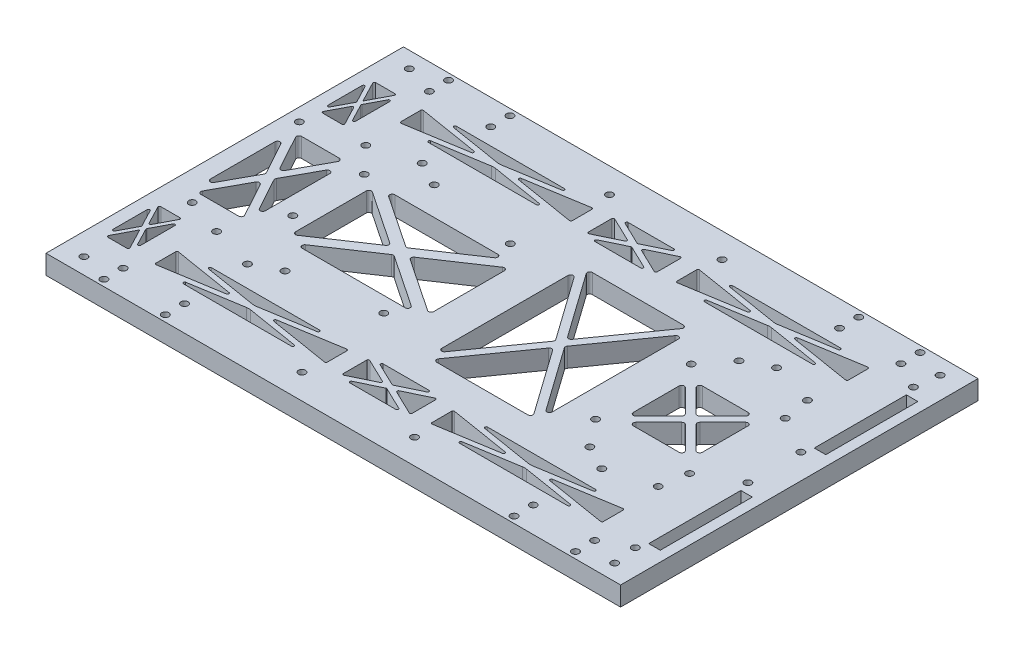
from build123d import *

# Parameters (mm, degrees)
SKETCH6_W                               = 224.59
SKETCH6_H                               = 139.7
CHASSISBASE_DEPTH                       = 7.5
ARDUINOMEGAMOUNTINGHOLESSKETCH_R        = 1.375
ARDUINOMEGAMOUNTINGHOLES_DEPTH          = 7.5
FRONTMOTORMOUNTINGHOLESSKETCH_R         = 1.375
FRONTMOTORMOUNTINGHOLES_DEPTH           = 7.5
L298MOTORDRIVERMOUNTINGHOLESSKETCH_R    = 1.375
L298MOTORDRIVERMOUNTINGHOLES_DEPTH      = 7.5
COUPLINGCOLLARMOUNTINGHOLESSKETCH_R     = 1.375
COUPLINGCOLLARMOUNTINGHOLES_DEPTH       = 7.5
SIDEDISTANCESENSORMOUNTINGHOLESSKETCH_R = 1.375
SIDEDISTANCESENSORMOUNTINGHOLES_DEPTH   = 7.5
TOPCHASSISMOUNTINGHOLESSKETCH_R         = 1.375
TOPCHASSISMOUNTINGHOLES_DEPTH           = 7.5
REARSENSORMOUNTINGHOLESSKETCH_R         = 1.375
REARSENSORMOUNTINGHOLES_DEPTH           = 7.5
SKETCH7_W                               = 4.5
SKETCH7_H                               = 36
WEIGHTREDUCTION_DEPTH                   = 245.559130069


with BuildPart() as part:
    # Sketch6 → chassisBase (new body)
    with BuildSketch(Plane(origin=(0, 0, 0), x_dir=(1, 0, 0), z_dir=(0, 1, 0))):
        with Locations((112.295, 26.65)):
            Rectangle(SKETCH6_W, SKETCH6_H)
    extrude(amount=CHASSISBASE_DEPTH)

    # arduinoMegaMountingHolesSketch → arduinoMegaMountingHoles (cut)
    with BuildSketch(Plane(origin=(0, 0, 0), x_dir=(1, 0, 0), z_dir=(0, 1, 0))):
        with Locations((5.05, 50.76)):
            Circle(ARDUINOMEGAMOUNTINGHOLESSKETCH_R)
        with Locations((87.52, 50.76)):
            Circle(ARDUINOMEGAMOUNTINGHOLESSKETCH_R)
        with Locations((86.29, 2.54)):
            Circle(ARDUINOMEGAMOUNTINGHOLESSKETCH_R)
        with Locations((11.41, 2.54)):
            Circle(ARDUINOMEGAMOUNTINGHOLESSKETCH_R)
        with Locations((35.5, 45.68)):
            Circle(ARDUINOMEGAMOUNTINGHOLESSKETCH_R)
        with Locations((35.5, 17.77)):
            Circle(ARDUINOMEGAMOUNTINGHOLESSKETCH_R)
    extrude(amount=ARDUINOMEGAMOUNTINGHOLES_DEPTH, mode=Mode.SUBTRACT)

    # frontMotorMountingHolesSketch → frontMotorMountingHoles (cut)
    with BuildSketch(Plane(origin=(0, 0, 0), x_dir=(1, 0, 0), z_dir=(0, 1, 0))):
        with Locations((25.985, 55.8)):
            Circle(FRONTMOTORMOUNTINGHOLESSKETCH_R)
        with Locations((43.035, 60.8)):
            Circle(FRONTMOTORMOUNTINGHOLESSKETCH_R)
        with Locations((52.735, 55.8)):
            Circle(FRONTMOTORMOUNTINGHOLESSKETCH_R)
        with Locations((25.985, -2.5)):
            Circle(FRONTMOTORMOUNTINGHOLESSKETCH_R)
        with Locations((43.035, -7.5)):
            Circle(FRONTMOTORMOUNTINGHOLESSKETCH_R)
        with Locations((52.735, -2.5)):
            Circle(FRONTMOTORMOUNTINGHOLESSKETCH_R)
    extrude(amount=FRONTMOTORMOUNTINGHOLES_DEPTH, mode=Mode.SUBTRACT)

    # L298motorDriverMountingHolesSketch → L298motorDriverMountingHoles (cut)
    with BuildSketch(Plane(origin=(0, 0, 0), x_dir=(1, 0, 0), z_dir=(0, 1, 0))):
        with Locations((163.60569727, 45.38594237)):
            Circle(L298MOTORDRIVERMOUNTINGHOLESSKETCH_R)
        with Locations((163.60569727, 8.0064415)):
            Circle(L298MOTORDRIVERMOUNTINGHOLESSKETCH_R)
        with Locations((200.347497622, 45.38594237)):
            Circle(L298MOTORDRIVERMOUNTINGHOLESSKETCH_R)
        with Locations((200.34749759, 8.0064415)):
            Circle(L298MOTORDRIVERMOUNTINGHOLESSKETCH_R)
        with Locations((171.855, 55.8)):
            Circle(L298MOTORDRIVERMOUNTINGHOLESSKETCH_R)
        with Locations((181.555, 60.8)):
            Circle(L298MOTORDRIVERMOUNTINGHOLESSKETCH_R)
        with Locations((198.605, 55.8)):
            Circle(L298MOTORDRIVERMOUNTINGHOLESSKETCH_R)
        with Locations((198.605, -2.5)):
            Circle(L298MOTORDRIVERMOUNTINGHOLESSKETCH_R)
        with Locations((181.555, -7.5)):
            Circle(L298MOTORDRIVERMOUNTINGHOLESSKETCH_R)
        with Locations((171.855, -2.5)):
            Circle(L298MOTORDRIVERMOUNTINGHOLESSKETCH_R)
    extrude(amount=L298MOTORDRIVERMOUNTINGHOLES_DEPTH, mode=Mode.SUBTRACT)

    # couplingCollarMountingHolesSketch → couplingCollarMountingHoles (cut)
    with BuildSketch(Plane(origin=(0, 0, 0), x_dir=(1, 0, 0), z_dir=(0, 1, 0))):
        with Locations((20.135, 86.5)):
            Circle(COUPLINGCOLLARMOUNTINGHOLESSKETCH_R)
        with Locations((20.135, 94)):
            Circle(COUPLINGCOLLARMOUNTINGHOLESSKETCH_R)
        with Locations((44.135, 86.5)):
            Circle(COUPLINGCOLLARMOUNTINGHOLESSKETCH_R)
        with Locations((44.135, 94)):
            Circle(COUPLINGCOLLARMOUNTINGHOLESSKETCH_R)
        with Locations((204.455, 86.5)):
            Circle(COUPLINGCOLLARMOUNTINGHOLESSKETCH_R)
        with Locations((180.455, 86.5)):
            Circle(COUPLINGCOLLARMOUNTINGHOLESSKETCH_R)
        with Locations((180.455, 94)):
            Circle(COUPLINGCOLLARMOUNTINGHOLESSKETCH_R)
        with Locations((204.455, 94)):
            Circle(COUPLINGCOLLARMOUNTINGHOLESSKETCH_R)
        with Locations((20.135, -33.2)):
            Circle(COUPLINGCOLLARMOUNTINGHOLESSKETCH_R)
        with Locations((44.135, -33.2)):
            Circle(COUPLINGCOLLARMOUNTINGHOLESSKETCH_R)
        with Locations((44.135, -40.7)):
            Circle(COUPLINGCOLLARMOUNTINGHOLESSKETCH_R)
        with Locations((20.135, -40.7)):
            Circle(COUPLINGCOLLARMOUNTINGHOLESSKETCH_R)
        with Locations((180.455, -33.2)):
            Circle(COUPLINGCOLLARMOUNTINGHOLESSKETCH_R)
        with Locations((204.455, -33.2)):
            Circle(COUPLINGCOLLARMOUNTINGHOLESSKETCH_R)
        with Locations((204.455, -40.7)):
            Circle(COUPLINGCOLLARMOUNTINGHOLESSKETCH_R)
        with Locations((180.455, -40.7)):
            Circle(COUPLINGCOLLARMOUNTINGHOLESSKETCH_R)
    extrude(amount=COUPLINGCOLLARMOUNTINGHOLES_DEPTH, mode=Mode.SUBTRACT)

    # sideDistanceSensorMountingHolesSketch → sideDistanceSensorMountingHoles (cut)
    with BuildSketch(Plane(origin=(0, 0, 0), x_dir=(1, 0, 0), z_dir=(0, 1, 0))):
        with Locations((90.295, -33.45)):
            Circle(SIDEDISTANCESENSORMOUNTINGHOLESSKETCH_R)
        with Locations((134.295, -33.45)):
            Circle(SIDEDISTANCESENSORMOUNTINGHOLESSKETCH_R)
        with Locations((90.295, 86.75)):
            Circle(SIDEDISTANCESENSORMOUNTINGHOLESSKETCH_R)
        with Locations((134.295, 86.75)):
            Circle(SIDEDISTANCESENSORMOUNTINGHOLESSKETCH_R)
    extrude(amount=SIDEDISTANCESENSORMOUNTINGHOLES_DEPTH, mode=Mode.SUBTRACT)

    # topChassisMountingHolesSketch → topChassisMountingHoles (cut)
    with BuildSketch(Plane(origin=(0, 0, 0), x_dir=(1, 0, 0), z_dir=(0, 1, 0))):
        with Locations((8.5675, 90.25)):
            Circle(TOPCHASSISMOUNTINGHOLESSKETCH_R)
        with Locations((8.5675, -36.95)):
            Circle(TOPCHASSISMOUNTINGHOLESSKETCH_R)
        with Locations((216.0225, 90.25)):
            Circle(TOPCHASSISMOUNTINGHOLESSKETCH_R)
        with Locations((216.0225, -36.95)):
            Circle(TOPCHASSISMOUNTINGHOLESSKETCH_R)
    extrude(amount=TOPCHASSISMOUNTINGHOLES_DEPTH, mode=Mode.SUBTRACT)

    # rearSensorMountingHolesSketch → rearSensorMountingHoles (cut)
    with BuildSketch(Plane(origin=(0, 0, 0), x_dir=(1, 0, 0), z_dir=(0, 1, 0))):
        with Locations((214.84, 81)):
            Circle(REARSENSORMOUNTINGHOLESSKETCH_R)
        with Locations((214.84, 37)):
            Circle(REARSENSORMOUNTINGHOLESSKETCH_R)
        with Locations((214.84, -27.7)):
            Circle(REARSENSORMOUNTINGHOLESSKETCH_R)
        with Locations((214.84, 16.3)):
            Circle(REARSENSORMOUNTINGHOLESSKETCH_R)
    extrude(amount=REARSENSORMOUNTINGHOLES_DEPTH, mode=Mode.SUBTRACT)

    # Sketch7 → weightReduction (cut, through all)
    with BuildSketch(Plane(origin=(0, 7.5, 0), x_dir=(1, 0, 0), z_dir=(0, 1, 0))):
        with BuildLine():
            Line((170.362106781, 36.321572875), (179.326572875, 27.357106781))
            ThreePointArc((179.326572875, 27.357106781), (179.619466094, 26.65), (179.326572875, 25.942893219))
            Line((179.326572875, 25.942893219), (170.362106781, 16.978427125))
            ThreePointArc((170.362106781, 16.978427125), (169.272316568, 16.761654373), (168.655, 17.685533906))
            Line((168.655, 17.685533906), (168.655, 35.614466094))
            ThreePointArc((168.655, 35.614466094), (169.272316568, 36.538345627), (170.362106781, 36.321572875))
        make_face()
        with BuildLine():
            Line((172.483427125, 38.442893219), (181.447893219, 29.478427125))
            ThreePointArc((181.447893219, 29.478427125), (182.155, 29.185533906), (182.862106781, 29.478427125))
            Line((182.862106781, 29.478427125), (191.826572875, 38.442893219))
            ThreePointArc((191.826572875, 38.442893219), (192.043345627, 39.532683432), (191.119466094, 40.15))
            Line((191.119466094, 40.15), (173.190533906, 40.15))
            ThreePointArc((173.190533906, 40.15), (172.266654373, 39.532683432), (172.483427125, 38.442893219))
        make_face()
        with BuildLine():
            Line((173.190533906, 13.15), (191.119466094, 13.15))
            ThreePointArc((191.119466094, 13.15), (192.043345627, 13.767316568), (191.826572875, 14.857106781))
            Line((191.826572875, 14.857106781), (182.862106781, 23.821572875))
            ThreePointArc((182.862106781, 23.821572875), (182.155, 24.114466094), (181.447893219, 23.821572875))
            Line((181.447893219, 23.821572875), (172.483427125, 14.857106781))
            ThreePointArc((172.483427125, 14.857106781), (172.266654373, 13.767316568), (173.190533906, 13.15))
        make_face()
        with BuildLine():
            Line((195.655, 17.685533906), (195.655, 35.614466094))
            ThreePointArc((195.655, 35.614466094), (195.037683432, 36.538345627), (193.947893219, 36.321572875))
            Line((193.947893219, 36.321572875), (184.983427125, 27.357106781))
            ThreePointArc((184.983427125, 27.357106781), (184.690533906, 26.65), (184.983427125, 25.942893219))
            Line((184.983427125, 25.942893219), (193.947893219, 16.978427125))
            ThreePointArc((193.947893219, 16.978427125), (195.037683432, 16.761654373), (195.655, 17.685533906))
        make_face()
        with BuildLine():
            Line((113.294715761, -3.75), (148.880284239, -3.75))
            ThreePointArc((148.880284239, -3.75), (149.768717571, -3.209005681), (149.695876132, -2.17137243))
            Line((149.695876132, -2.17137243), (131.903091892, 22.908059163))
            ThreePointArc((131.903091892, 22.908059163), (131.0875, 23.329431593), (130.271908108, 22.908059163))
            Line((130.271908108, 22.908059163), (112.479123868, -2.17137243))
            ThreePointArc((112.479123868, -2.17137243), (112.406282429, -3.209005681), (113.294715761, -3.75))
        make_face()
        with BuildLine():
            Line((109.52, 1.980096633), (109.52, 51.319903367))
            ThreePointArc((109.52, 51.319903367), (110.216348796, 52.27268663), (111.335591892, 51.898530938))
            Line((111.335591892, 51.898530938), (128.837833368, 27.22862757))
            ThreePointArc((128.837833368, 27.22862757), (129.022241476, 26.65), (128.837833368, 26.07137243))
            Line((128.837833368, 26.07137243), (111.335591892, 1.401469062))
            ThreePointArc((111.335591892, 1.401469062), (110.216348796, 1.02731337), (109.52, 1.980096633))
        make_face()
        with BuildLine():
            Line((113.294715761, 57.05), (148.880284239, 57.05))
            ThreePointArc((148.880284239, 57.05), (149.768717571, 56.509005681), (149.695876132, 55.47137243))
            Line((149.695876132, 55.47137243), (131.903091892, 30.391940837))
            ThreePointArc((131.903091892, 30.391940837), (131.0875, 29.970568407), (130.271908108, 30.391940837))
            Line((130.271908108, 30.391940837), (112.479123868, 55.47137243))
            ThreePointArc((112.479123868, 55.47137243), (112.406282429, 56.509005681), (113.294715761, 57.05))
        make_face()
        with BuildLine():
            Line((152.655, 1.980096633), (152.655, 51.319903367))
            ThreePointArc((152.655, 51.319903367), (151.958651204, 52.27268663), (150.839408108, 51.898530938))
            Line((150.839408108, 51.898530938), (133.337166632, 27.22862757))
            ThreePointArc((133.337166632, 27.22862757), (133.152758524, 26.65), (133.337166632, 26.07137243))
            Line((133.337166632, 26.07137243), (150.839408108, 1.401469062))
            ThreePointArc((150.839408108, 1.401469062), (151.958651204, 1.02731337), (152.655, 1.980096633))
        make_face()
        with BuildLine():
            Line((103.334561275, 81), (121.255438725, 81))
            ThreePointArc((121.255438725, 81), (121.742926141, 80.611157634), (121.472190515, 80.049424078))
            Line((121.472190515, 80.049424078), (112.51175179, 75.738960427))
            ThreePointArc((112.51175179, 75.738960427), (112.295, 75.689536349), (112.07824821, 75.738960427))
            Line((112.07824821, 75.738960427), (103.117809485, 80.049424078))
            ThreePointArc((103.117809485, 80.049424078), (102.847073859, 80.611157634), (103.334561275, 81))
        make_face()
        with BuildLine():
            Line((125.755, 69.955063838), (125.755, 79.094936162))
            ThreePointArc((125.755, 79.094936162), (125.521105341, 79.518242136), (125.03824821, 79.545512084))
            Line((125.03824821, 79.545512084), (115.538427245, 74.975575922))
            ThreePointArc((115.538427245, 74.975575922), (115.255179035, 74.525), (115.538427245, 74.074424078))
            Line((115.538427245, 74.074424078), (125.03824821, 69.504487916))
            ThreePointArc((125.03824821, 69.504487916), (125.521105341, 69.531757864), (125.755, 69.955063838))
        make_face()
        with BuildLine():
            Line((37.11356333, -25.706546713), (57.528535299, -22.370069951))
            ThreePointArc((57.528535299, -22.370069951), (58.335, -22.304602825), (59.141464701, -22.370069951))
            Line((59.141464701, -22.370069951), (79.55643667, -25.706546713))
            ThreePointArc((79.55643667, -25.706546713), (79.974150834, -26.240455879), (79.4757902, -26.7))
            Line((79.4757902, -26.7), (37.1942098, -26.7))
            ThreePointArc((37.1942098, -26.7), (36.695849166, -26.240455879), (37.11356333, -25.706546713))
        make_face()
        with BuildLine():
            Line((6.672598406, 58.3), (14.162401594, 58.3))
            ThreePointArc((14.162401594, 58.3), (14.59014905, 58.541094392), (14.605386455, 59.031871544))
            Line((14.605386455, 59.031871544), (10.860484861, 66.186413584))
            ThreePointArc((10.860484861, 66.186413584), (10.4175, 66.454542039), (9.974515139, 66.186413584))
            Line((9.974515139, 66.186413584), (6.229613545, 59.031871544))
            ThreePointArc((6.229613545, 59.031871544), (6.24485095, 58.541094392), (6.672598406, 58.3))
        make_face()
        with BuildLine():
            Line((5, 61.950695617), (5, 75.349304383))
            ThreePointArc((5, 75.349304383), (5.380610784, 75.834841421), (5.942984861, 75.581175928))
            Line((5.942984861, 75.581175928), (9.449601431, 68.881871544))
            ThreePointArc((9.449601431, 68.881871544), (9.50661657, 68.65), (9.449601431, 68.418128456))
            Line((9.449601431, 68.418128456), (5.942984861, 61.718824072))
            ThreePointArc((5.942984861, 61.718824072), (5.380610784, 61.465158579), (5, 61.950695617))
        make_face()
        with BuildLine():
            Line((6.672598406, 79), (14.162401594, 79))
            ThreePointArc((14.162401594, 79), (14.59014905, 78.758905608), (14.605386455, 78.268128456))
            Line((14.605386455, 78.268128456), (10.4175, 70.267274776))
            Line((10.4175, 70.267274776), (6.229613545, 78.268128456))
            ThreePointArc((6.229613545, 78.268128456), (6.24485095, 78.758905608), (6.672598406, 79))
        make_face()
        with BuildLine():
            Line((15.835, 61.950695617), (15.835, 75.349304383))
            ThreePointArc((15.835, 75.349304383), (15.454389216, 75.834841421), (14.892015139, 75.581175928))
            Line((14.892015139, 75.581175928), (11.385398569, 68.881871544))
            ThreePointArc((11.385398569, 68.881871544), (11.32838343, 68.65), (11.385398569, 68.418128456))
            Line((11.385398569, 68.418128456), (14.892015139, 61.718824072))
            ThreePointArc((14.892015139, 61.718824072), (15.454389216, 61.465158579), (15.835, 61.950695617))
        make_face()
        with BuildLine():
            Line((24.835, -17.351617124), (24.835, -25.098382876))
            ThreePointArc((24.835, -25.098382876), (25.011212442, -25.479383686), (25.41564647, -25.591836163))
            Line((25.41564647, -25.591836163), (49.1157974, -21.718453287))
            ThreePointArc((49.1157974, -21.718453287), (49.53515093, -21.225), (49.1157974, -20.731546713))
            Line((49.1157974, -20.731546713), (25.41564647, -16.858163837))
            ThreePointArc((25.41564647, -16.858163837), (25.011212442, -16.970616314), (24.835, -17.351617124))
        make_face()
        with BuildLine():
            Line((91.835, -25.098382876), (91.835, -17.351617124))
            ThreePointArc((91.835, -17.351617124), (91.658787558, -16.970616314), (91.25435353, -16.858163837))
            Line((91.25435353, -16.858163837), (67.5542026, -20.731546713))
            ThreePointArc((67.5542026, -20.731546713), (67.13484907, -21.225), (67.5542026, -21.718453287))
            Line((67.5542026, -21.718453287), (91.25435353, -25.591836163))
            ThreePointArc((91.25435353, -25.591836163), (91.658787558, -25.479383686), (91.835, -25.098382876))
        make_face()
        with BuildLine():
            Line((79.4757902, -15.75), (37.1942098, -15.75))
            ThreePointArc((37.1942098, -15.75), (36.695849166, -16.209544121), (37.11356333, -16.743453287))
            Line((37.11356333, -16.743453287), (57.528535299, -20.079930049))
            ThreePointArc((57.528535299, -20.079930049), (58.335, -20.145397175), (59.141464701, -20.079930049))
            Line((59.141464701, -20.079930049), (79.55643667, -16.743453287))
            ThreePointArc((79.55643667, -16.743453287), (79.974150834, -16.209544121), (79.4757902, -15.75))
        make_face()
        with BuildLine():
            Line((10.396733566, 46.3), (25.103266434, 46.3))
            ThreePointArc((25.103266434, 46.3), (25.963483437, 45.809928139), (25.980564146, 44.820053415))
            Line((25.980564146, 44.820053415), (18.627297712, 31.378966398))
            ThreePointArc((18.627297712, 31.378966398), (17.75, 30.858912984), (16.872702288, 31.378966398))
            Line((16.872702288, 31.378966398), (9.519435854, 44.820053415))
            ThreePointArc((9.519435854, 44.820053415), (9.536516563, 45.809928139), (10.396733566, 46.3))
        make_face()
        with BuildLine():
            Line((28.5, 14.036819961), (28.5, 39.263180039))
            ThreePointArc((28.5, 39.263180039), (27.747691631, 40.232018961), (26.622702288, 39.743126625))
            Line((26.622702288, 39.743126625), (19.722362063, 27.129946585))
            ThreePointArc((19.722362063, 27.129946585), (19.599659775, 26.65), (19.722362063, 26.170053415))
            Line((19.722362063, 26.170053415), (26.622702288, 13.556873375))
            ThreePointArc((26.622702288, 13.556873375), (27.747691631, 13.067981039), (28.5, 14.036819961))
        make_face()
        with BuildLine():
            Line((10.396733566, 7), (25.103266434, 7))
            ThreePointArc((25.103266434, 7), (25.963483437, 7.490071861), (25.980564146, 8.479946585))
            Line((25.980564146, 8.479946585), (18.627297712, 21.921033602))
            ThreePointArc((18.627297712, 21.921033602), (17.75, 22.441087016), (16.872702288, 21.921033602))
            Line((16.872702288, 21.921033602), (9.519435854, 8.479946585))
            ThreePointArc((9.519435854, 8.479946585), (9.536516563, 7.490071861), (10.396733566, 7))
        make_face()
        with BuildLine():
            Line((7, 14.036819961), (7, 39.263180039))
            ThreePointArc((7, 39.263180039), (7.752308369, 40.232018961), (8.877297712, 39.743126625))
            Line((8.877297712, 39.743126625), (15.777637937, 27.129946585))
            ThreePointArc((15.777637937, 27.129946585), (15.900340225, 26.65), (15.777637937, 26.170053415))
            Line((15.777637937, 26.170053415), (8.877297712, 13.556873375))
            ThreePointArc((8.877297712, 13.556873375), (7.752308369, 13.067981039), (7, 14.036819961))
        make_face()
        with BuildLine():
            Line((48.37842286, 44.76), (88.64157714, 44.76))
            ThreePointArc((88.64157714, 44.76), (89.598285248, 44.051049131), (89.198475267, 42.929419193))
            Line((89.198475267, 42.929419193), (69.066898127, 29.431349515))
            ThreePointArc((69.066898127, 29.431349515), (68.51, 29.261930322), (67.953101873, 29.431349515))
            Line((67.953101873, 29.431349515), (47.821524733, 42.929419193))
            ThreePointArc((47.821524733, 42.929419193), (47.421714752, 44.051049131), (48.37842286, 44.76))
        make_face()
        with BuildLine():
            Line((95.52, 12.822422732), (95.52, 40.477577268))
            ThreePointArc((95.52, 40.477577268), (94.990691976, 41.359874873), (93.963101873, 41.308158075))
            Line((93.963101873, 41.308158075), (73.34008354, 27.480580807))
            ThreePointArc((73.34008354, 27.480580807), (72.896981667, 26.65), (73.34008354, 25.819419193))
            Line((73.34008354, 25.819419193), (93.963101873, 11.991841925))
            ThreePointArc((93.963101873, 11.991841925), (94.990691976, 11.940125127), (95.52, 12.822422732))
        make_face()
        with BuildLine():
            Line((48.37842286, 8.54), (88.64157714, 8.54))
            ThreePointArc((88.64157714, 8.54), (89.598285248, 9.248950869), (89.198475267, 10.370580807))
            Line((89.198475267, 10.370580807), (69.066898127, 23.868650485))
            ThreePointArc((69.066898127, 23.868650485), (68.51, 24.038069678), (67.953101873, 23.868650485))
            Line((67.953101873, 23.868650485), (47.821524733, 10.370580807))
            ThreePointArc((47.821524733, 10.370580807), (47.421714752, 9.248950869), (48.37842286, 8.54))
        make_face()
        with BuildLine():
            Line((41.5, 12.822422732), (41.5, 40.477577268))
            ThreePointArc((41.5, 40.477577268), (42.029308024, 41.359874873), (43.056898127, 41.308158075))
            Line((43.056898127, 41.308158075), (63.67991646, 27.480580807))
            ThreePointArc((63.67991646, 27.480580807), (64.123018333, 26.65), (63.67991646, 25.819419193))
            Line((63.67991646, 25.819419193), (43.056898127, 11.991841925))
            ThreePointArc((43.056898127, 11.991841925), (42.029308024, 11.940125127), (41.5, 12.822422732))
        make_face()
        with BuildLine():
            Line((103.334561275, 68.05), (121.255438725, 68.05))
            ThreePointArc((121.255438725, 68.05), (121.742926141, 68.438842366), (121.472190515, 69.000575922))
            Line((121.472190515, 69.000575922), (112.51175179, 73.311039573))
            ThreePointArc((112.51175179, 73.311039573), (112.295, 73.360463651), (112.07824821, 73.311039573))
            Line((112.07824821, 73.311039573), (103.117809485, 69.000575922))
            ThreePointArc((103.117809485, 69.000575922), (102.847073859, 68.438842366), (103.334561275, 68.05))
        make_face()
        with BuildLine():
            Line((98.835, 69.955063838), (98.835, 79.094936162))
            ThreePointArc((98.835, 79.094936162), (99.068894659, 79.518242136), (99.55175179, 79.545512084))
            Line((99.55175179, 79.545512084), (109.051572755, 74.975575922))
            ThreePointArc((109.051572755, 74.975575922), (109.334820965, 74.525), (109.051572755, 74.074424078))
            Line((109.051572755, 74.074424078), (99.55175179, 69.504487916))
            ThreePointArc((99.55175179, 69.504487916), (99.068894659, 69.531757864), (98.835, 69.955063838))
        make_face()
        with BuildLine():
            Line((25.41564647, 70.158163837), (49.1157974, 74.031546713))
            ThreePointArc((49.1157974, 74.031546713), (49.53515093, 74.525), (49.1157974, 75.018453287))
            Line((49.1157974, 75.018453287), (25.41564647, 78.891836163))
            ThreePointArc((25.41564647, 78.891836163), (25.011212442, 78.779383686), (24.835, 78.398382876))
            Line((24.835, 78.398382876), (24.835, 70.651617124))
            ThreePointArc((24.835, 70.651617124), (25.011212442, 70.270616314), (25.41564647, 70.158163837))
        make_face()
        with BuildLine():
            Line((37.11356333, 79.006546713), (57.528535299, 75.670069951))
            ThreePointArc((57.528535299, 75.670069951), (58.335, 75.604602825), (59.141464701, 75.670069951))
            Line((59.141464701, 75.670069951), (79.55643667, 79.006546713))
            ThreePointArc((79.55643667, 79.006546713), (79.974150834, 79.540455879), (79.4757902, 80))
            Line((79.4757902, 80), (37.1942098, 80))
            ThreePointArc((37.1942098, 80), (36.695849166, 79.540455879), (37.11356333, 79.006546713))
        make_face()
        with BuildLine():
            Line((67.5542026, 75.018453287), (91.25435353, 78.891836163))
            ThreePointArc((91.25435353, 78.891836163), (91.658787558, 78.779383686), (91.835, 78.398382876))
            Line((91.835, 78.398382876), (91.835, 70.651617124))
            ThreePointArc((91.835, 70.651617124), (91.658787558, 70.270616314), (91.25435353, 70.158163837))
            Line((91.25435353, 70.158163837), (67.5542026, 74.031546713))
            ThreePointArc((67.5542026, 74.031546713), (67.13484907, 74.525), (67.5542026, 75.018453287))
        make_face()
        with BuildLine():
            Line((59.141464701, 73.379930049), (79.55643667, 70.043453287))
            ThreePointArc((79.55643667, 70.043453287), (79.974150834, 69.509544121), (79.4757902, 69.05))
            Line((79.4757902, 69.05), (37.1942098, 69.05))
            ThreePointArc((37.1942098, 69.05), (36.695849166, 69.509544121), (37.11356333, 70.043453287))
            Line((37.11356333, 70.043453287), (57.528535299, 73.379930049))
            ThreePointArc((57.528535299, 73.379930049), (58.335, 73.445397175), (59.141464701, 73.379930049))
        make_face()
        with BuildLine():
            Line((157.0357974, -21.718453287), (133.33564647, -25.591836163))
            ThreePointArc((133.33564647, -25.591836163), (132.931212442, -25.479383686), (132.755, -25.098382876))
            Line((132.755, -25.098382876), (132.755, -17.351617124))
            ThreePointArc((132.755, -17.351617124), (132.931212442, -16.970616314), (133.33564647, -16.858163837))
            Line((133.33564647, -16.858163837), (157.0357974, -20.731546713))
            ThreePointArc((157.0357974, -20.731546713), (157.45515093, -21.225), (157.0357974, -21.718453287))
        make_face()
        with BuildLine():
            Line((187.47643667, -25.706546713), (167.061464701, -22.370069951))
            ThreePointArc((167.061464701, -22.370069951), (166.255, -22.304602825), (165.448535299, -22.370069951))
            Line((165.448535299, -22.370069951), (145.03356333, -25.706546713))
            ThreePointArc((145.03356333, -25.706546713), (144.615849166, -26.240455879), (145.1142098, -26.7))
            Line((145.1142098, -26.7), (187.3957902, -26.7))
            ThreePointArc((187.3957902, -26.7), (187.894150834, -26.240455879), (187.47643667, -25.706546713))
        make_face()
        with BuildLine():
            Line((199.17435353, -16.858163837), (175.4742026, -20.731546713))
            ThreePointArc((175.4742026, -20.731546713), (175.05484907, -21.225), (175.4742026, -21.718453287))
            Line((175.4742026, -21.718453287), (199.17435353, -25.591836163))
            ThreePointArc((199.17435353, -25.591836163), (199.578787558, -25.479383686), (199.755, -25.098382876))
            Line((199.755, -25.098382876), (199.755, -17.351617124))
            ThreePointArc((199.755, -17.351617124), (199.578787558, -16.970616314), (199.17435353, -16.858163837))
        make_face()
        with BuildLine():
            Line((165.448535299, -20.079930049), (145.03356333, -16.743453287))
            ThreePointArc((145.03356333, -16.743453287), (144.615849166, -16.209544121), (145.1142098, -15.75))
            Line((145.1142098, -15.75), (187.3957902, -15.75))
            ThreePointArc((187.3957902, -15.75), (187.894150834, -16.209544121), (187.47643667, -16.743453287))
            Line((187.47643667, -16.743453287), (167.061464701, -20.079930049))
            ThreePointArc((167.061464701, -20.079930049), (166.255, -20.145397175), (165.448535299, -20.079930049))
        make_face()
        with BuildLine():
            Line((187.47643667, 70.043453287), (167.061464701, 73.379930049))
            ThreePointArc((167.061464701, 73.379930049), (166.255, 73.445397175), (165.448535299, 73.379930049))
            Line((165.448535299, 73.379930049), (145.03356333, 70.043453287))
            ThreePointArc((145.03356333, 70.043453287), (144.615849166, 69.509544121), (145.1142098, 69.05))
            Line((145.1142098, 69.05), (187.3957902, 69.05))
            ThreePointArc((187.3957902, 69.05), (187.894150834, 69.509544121), (187.47643667, 70.043453287))
        make_face()
        with BuildLine():
            Line((157.0357974, 74.031546713), (133.33564647, 70.158163837))
            ThreePointArc((133.33564647, 70.158163837), (132.931212442, 70.270616314), (132.755, 70.651617124))
            Line((132.755, 70.651617124), (132.755, 78.398382876))
            ThreePointArc((132.755, 78.398382876), (132.931212442, 78.779383686), (133.33564647, 78.891836163))
            Line((133.33564647, 78.891836163), (157.0357974, 75.018453287))
            ThreePointArc((157.0357974, 75.018453287), (157.45515093, 74.525), (157.0357974, 74.031546713))
        make_face()
        with BuildLine():
            Line((187.3957902, 80), (145.1142098, 80))
            ThreePointArc((145.1142098, 80), (144.615849166, 79.540455879), (145.03356333, 79.006546713))
            Line((145.03356333, 79.006546713), (165.448535299, 75.670069951))
            ThreePointArc((165.448535299, 75.670069951), (166.255, 75.604602825), (167.061464701, 75.670069951))
            Line((167.061464701, 75.670069951), (187.47643667, 79.006546713))
            ThreePointArc((187.47643667, 79.006546713), (187.894150834, 79.540455879), (187.3957902, 80))
        make_face()
        with BuildLine():
            Line((199.755, 70.651617124), (199.755, 78.398382876))
            ThreePointArc((199.755, 78.398382876), (199.578787558, 78.779383686), (199.17435353, 78.891836163))
            Line((199.17435353, 78.891836163), (175.4742026, 75.018453287))
            ThreePointArc((175.4742026, 75.018453287), (175.05484907, 74.525), (175.4742026, 74.031546713))
            Line((175.4742026, 74.031546713), (199.17435353, 70.158163837))
            ThreePointArc((199.17435353, 70.158163837), (199.578787558, 70.270616314), (199.755, 70.651617124))
        make_face()
        with BuildLine():
            Line((5, -8.650695617), (5, -22.049304383))
            ThreePointArc((5, -22.049304383), (5.380610784, -22.534841421), (5.942984861, -22.281175928))
            Line((5.942984861, -22.281175928), (9.449601431, -15.581871544))
            ThreePointArc((9.449601431, -15.581871544), (9.50661657, -15.35), (9.449601431, -15.118128456))
            Line((9.449601431, -15.118128456), (5.942984861, -8.418824072))
            ThreePointArc((5.942984861, -8.418824072), (5.380610784, -8.165158579), (5, -8.650695617))
        make_face()
        with BuildLine():
            Line((6.229613545, -5.731871544), (9.974515139, -12.886413584))
            ThreePointArc((9.974515139, -12.886413584), (10.4175, -13.154542039), (10.860484861, -12.886413584))
            Line((10.860484861, -12.886413584), (14.605386455, -5.731871544))
            ThreePointArc((14.605386455, -5.731871544), (14.59014905, -5.241094392), (14.162401594, -5))
            Line((14.162401594, -5), (6.672598406, -5))
            ThreePointArc((6.672598406, -5), (6.24485095, -5.241094392), (6.229613545, -5.731871544))
        make_face()
        with BuildLine():
            Line((11.385398569, -15.581871544), (14.892015139, -22.281175928))
            ThreePointArc((14.892015139, -22.281175928), (15.454389216, -22.534841421), (15.835, -22.049304383))
            Line((15.835, -22.049304383), (15.835, -8.650695617))
            ThreePointArc((15.835, -8.650695617), (15.454389216, -8.165158579), (14.892015139, -8.418824072))
            Line((14.892015139, -8.418824072), (11.385398569, -15.118128456))
            ThreePointArc((11.385398569, -15.118128456), (11.32838343, -15.35), (11.385398569, -15.581871544))
        make_face()
        with BuildLine():
            Line((6.229613545, -24.968128456), (10.4175, -16.967274776))
            Line((10.4175, -16.967274776), (14.605386455, -24.968128456))
            ThreePointArc((14.605386455, -24.968128456), (14.59014905, -25.458905608), (14.162401594, -25.7))
            Line((14.162401594, -25.7), (6.672598406, -25.7))
            ThreePointArc((6.672598406, -25.7), (6.24485095, -25.458905608), (6.229613545, -24.968128456))
        make_face()
        with BuildLine():
            Line((115.538427245, -20.774424078), (125.03824821, -16.204487916))
            ThreePointArc((125.03824821, -16.204487916), (125.521105341, -16.231757864), (125.755, -16.655063838))
            Line((125.755, -16.655063838), (125.755, -25.794936162))
            ThreePointArc((125.755, -25.794936162), (125.521105341, -26.218242136), (125.03824821, -26.245512084))
            Line((125.03824821, -26.245512084), (115.538427245, -21.675575922))
            ThreePointArc((115.538427245, -21.675575922), (115.255179035, -21.225), (115.538427245, -20.774424078))
        make_face()
        with BuildLine():
            Line((103.117809485, -15.700575922), (112.07824821, -20.011039573))
            ThreePointArc((112.07824821, -20.011039573), (112.295, -20.060463651), (112.51175179, -20.011039573))
            Line((112.51175179, -20.011039573), (121.472190515, -15.700575922))
            ThreePointArc((121.472190515, -15.700575922), (121.742926141, -15.138842366), (121.255438725, -14.75))
            Line((121.255438725, -14.75), (103.334561275, -14.75))
            ThreePointArc((103.334561275, -14.75), (102.847073859, -15.138842366), (103.117809485, -15.700575922))
        make_face()
        with BuildLine():
            Line((99.55175179, -16.204487916), (109.051572755, -20.774424078))
            ThreePointArc((109.051572755, -20.774424078), (109.334820965, -21.225), (109.051572755, -21.675575922))
            Line((109.051572755, -21.675575922), (99.55175179, -26.245512084))
            ThreePointArc((99.55175179, -26.245512084), (99.068894659, -26.218242136), (98.835, -25.794936162))
            Line((98.835, -25.794936162), (98.835, -16.655063838))
            ThreePointArc((98.835, -16.655063838), (99.068894659, -16.231757864), (99.55175179, -16.204487916))
        make_face()
        with BuildLine():
            Line((103.117809485, -26.749424078), (112.07824821, -22.438960427))
            ThreePointArc((112.07824821, -22.438960427), (112.295, -22.389536349), (112.51175179, -22.438960427))
            Line((112.51175179, -22.438960427), (121.472190515, -26.749424078))
            ThreePointArc((121.472190515, -26.749424078), (121.742926141, -27.311157634), (121.255438725, -27.7))
            Line((121.255438725, -27.7), (103.334561275, -27.7))
            ThreePointArc((103.334561275, -27.7), (102.847073859, -27.311157634), (103.117809485, -26.749424078))
        make_face()
        with Locations((218.34, 59)):
            Rectangle(SKETCH7_W, SKETCH7_H)
        with Locations((218.34, -5.7)):
            Rectangle(SKETCH7_W, SKETCH7_H)
    extrude(amount=-WEIGHTREDUCTION_DEPTH, mode=Mode.SUBTRACT)


solid = part.part
